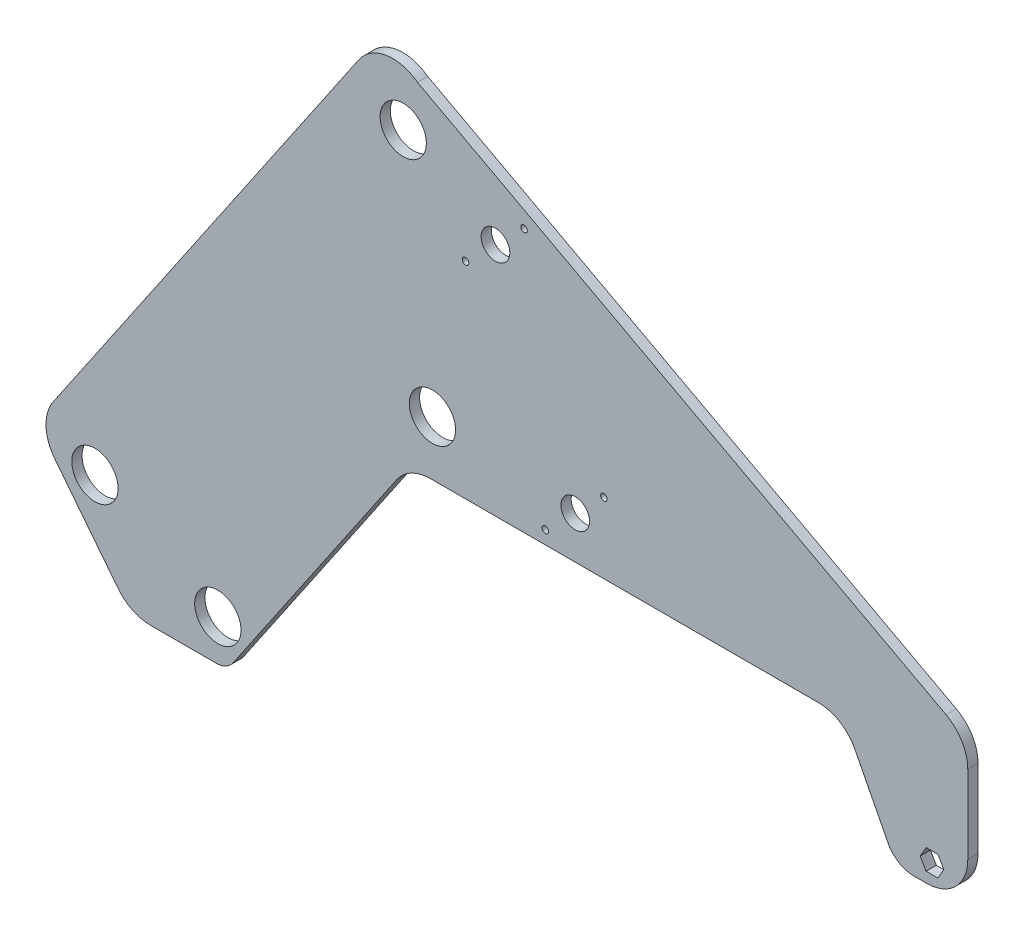
from build123d import *

# Parameters (mm, degrees)
MODEL_R             = 14.351
BOSS_EXTRUDE1_DEPTH = 6.35
SKETCH13_R          = 2.032
SKETCH13_R_2        = 8.89
CUT_EXTRUDE4_DEPTH  = 536.44023383


with BuildPart() as part:
    # Model → Boss-Extrude1 (new body)
    with BuildSketch(Plane.XY):
        with BuildLine():
            ThreePointArc((-212.899365952, 93.541257838), (-203.778989185, 101.701881024), (-191.901103209, 104.650248016))
            Line((-191.901103209, 104.650248016), (-112.960030528, 104.650248016))
            Line((-112.960030528, 104.650248016), (-68.510030528, 104.650248016))
            Line((-68.510030528, 104.650248016), (-11.396613492, 104.650248016))
            Line((-11.396613492, 104.650248016), (-2.138802982, 104.650248016))
            Line((-2.138802982, 104.650248016), (48.661197018, 104.650248016))
            ThreePointArc((48.661197018, 104.650248016), (61.901986038, 100.926075708), (71.260020742, 90.8456422))
            Line((71.260020742, 90.8456422), (91.800416921, 50.813472087))
            ThreePointArc((91.800416921, 50.813472087), (98.351041214, 43.757168632), (107.619593528, 41.150248016))
            Line((107.619593528, 41.150248016), (115.808590566, 41.150248016))
            ThreePointArc((115.808590566, 41.150248016), (133.769102808, 48.589735774), (141.208590566, 66.550248016))
            Line((141.208590566, 66.550248016), (141.208590566, 78.884578982))
            Line((141.208590566, 78.884578982), (141.208590566, 115.30333804))
            ThreePointArc((141.208590566, 115.30333804), (137.602779127, 128.348388632), (127.809114585, 137.689660276))
            Line((127.809114585, 137.689660276), (-86.332685344, 252.483586072))
            Line((-86.332685344, 252.483586072), (-122.300827258, 271.764848372))
            Line((-122.300827258, 271.764848372), (-199.949582693, 313.389629113))
            ThreePointArc((-199.949582693, 313.389629113), (-219.402189514, 318.224062751), (-236.303247901, 307.447705012))
            Line((-236.303247901, 307.447705012), (-425.920878295, 28.83612519))
            ThreePointArc((-425.920878295, 28.83612519), (-430.307847502, 13.679090678), (-424.898106806, -1.14372618))
            Line((-424.898106806, -1.14372618), (-385.58146606, -51.20282143))
            ThreePointArc((-385.58146606, -51.20282143), (-376.71145599, -58.357541068), (-365.605974805, -60.913979882))
            Line((-365.605974805, -60.913979882), (-324.737451002, -60.913979882))
            ThreePointArc((-324.737451002, -60.913979882), (-318.798508014, -59.439796386), (-314.23831963, -55.359484793))
            Line((-314.23831963, -55.359484793), (-212.899365952, 93.541257838))
        make_face()
        with Locations((-323.775189267, -35.513979882)):
            Circle(MODEL_R, mode=Mode.SUBTRACT)
        with Locations((-399.975189267, 2.586020118)):
            Circle(MODEL_R, mode=Mode.SUBTRACT)
        Polygon((122.716975548, 60.200248016), (126.383149757, 53.850248016), (122.716975548, 47.500248016), (115.384627129, 47.500248016), (114.742237203, 48.612900006), (111.71845292, 53.850248016), (115.384627129, 60.200248016), (121.352034814, 60.200248016), align=None, mode=Mode.SUBTRACT)
        with Locations((-190.707148919, 138.516914683)):
            Circle(MODEL_R, mode=Mode.SUBTRACT)
        with Locations((-208.832932893, 283.437784316)):
            Circle(MODEL_R, mode=Mode.SUBTRACT)
    extrude(amount=BOSS_EXTRUDE1_DEPTH)

    # Sketch13 → Cut-Extrude4 (cut, through all)
    with BuildSketch(Plane.XY.offset(6.35)):
        with Locations((-170.187872145, 232.259142896)):
            Circle(SKETCH13_R)
        with Locations((-151.625915728, 250.398241699)):
            Circle(SKETCH13_R_2)
        with Locations((-133.909415728, 267.819142896)):
            Circle(SKETCH13_R)
        with Locations((-120.713375516, 112.8022054)):
            Circle(SKETCH13_R)
        with Locations((-102.151419099, 130.941304203)):
            Circle(SKETCH13_R_2)
        with Locations((-84.434919099, 148.3622054)):
            Circle(SKETCH13_R)
    extrude(amount=-CUT_EXTRUDE4_DEPTH, mode=Mode.SUBTRACT)


solid = part.part
